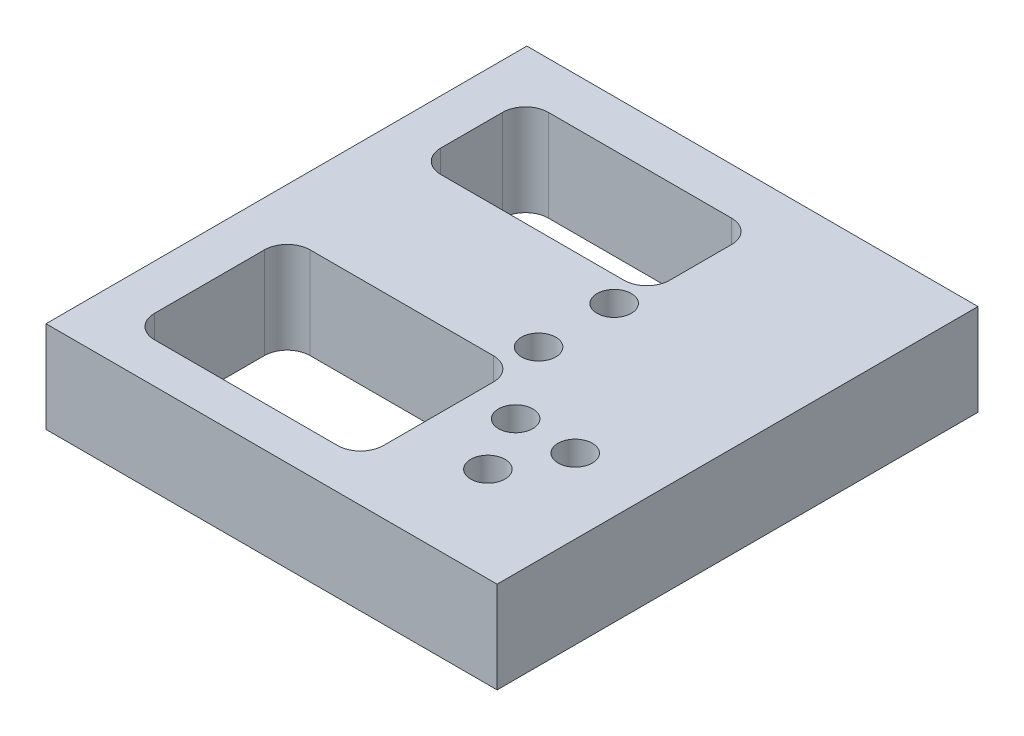
from build123d import *

# Parameters (mm, degrees)
SKETCH1_W           = 197
SKETCH1_H           = 210
BOSS_EXTRUDE1_DEPTH = 40
CUT_EXTRUDE2_REACH  = 151.423
SKETCH3_R           = 7.5
SKETCH4_R           = 9
CUT_EXTRUDE3_DEPTH  = 5


with BuildPart() as part:
    # Sketch1 → Boss-Extrude1 (new body)
    with BuildSketch(Plane(origin=(0, 0, 0), x_dir=(1, 0, 0), z_dir=(0, 1, 0))):
        Rectangle(SKETCH1_W, SKETCH1_H)
    extrude(amount=-BOSS_EXTRUDE1_DEPTH)

    # Sketch3 → Cut-Extrude2 (cut, up to next)
    with BuildSketch(Plane(origin=(0, 0, 0), x_dir=(1, 0, 0), z_dir=(0, 1, 0)), mode=Mode.PRIVATE) as cut_extrude2_sk1:
        with Locations((17.88, 26.73)):
            Circle(SKETCH3_R)
    cut_extrude2_tool1 = extrude(cut_extrude2_sk1.sketch, amount=-CUT_EXTRUDE2_REACH, mode=Mode.PRIVATE) & part.part
    # Sketch3 → Cut-Extrude2 (cut, up to next)
    with BuildSketch(Plane(origin=(0, 0, 0), x_dir=(1, 0, 0), z_dir=(0, 1, 0)), mode=Mode.PRIVATE) as cut_extrude2_sk2:
        with Locations((17.88, -6.27)):
            Circle(SKETCH3_R)
    cut_extrude2_tool2 = extrude(cut_extrude2_sk2.sketch, amount=-CUT_EXTRUDE2_REACH, mode=Mode.PRIVATE) & part.part
    # Sketch3 → Cut-Extrude2 (cut, up to next)
    with BuildSketch(Plane(origin=(0, 0, 0), x_dir=(1, 0, 0), z_dir=(0, 1, 0)), mode=Mode.PRIVATE) as cut_extrude2_sk3:
        with Locations((53, -63.53)):
            Circle(SKETCH3_R)
    cut_extrude2_tool3 = extrude(cut_extrude2_sk3.sketch, amount=-CUT_EXTRUDE2_REACH, mode=Mode.PRIVATE) & part.part
    # Sketch3 → Cut-Extrude2 (cut, up to next)
    with BuildSketch(Plane(origin=(0, 0, 0), x_dir=(1, 0, 0), z_dir=(0, 1, 0)), mode=Mode.PRIVATE) as cut_extrude2_sk4:
        with Locations((66, -38.4)):
            Circle(SKETCH3_R)
    cut_extrude2_tool4 = extrude(cut_extrude2_sk4.sketch, amount=-CUT_EXTRUDE2_REACH, mode=Mode.PRIVATE) & part.part
    # Sketch3 → Cut-Extrude2 (cut, up to next)
    with BuildSketch(Plane(origin=(0, 0, 0), x_dir=(1, 0, 0), z_dir=(0, 1, 0)), mode=Mode.PRIVATE) as cut_extrude2_sk5:
        with Locations((40, -38.4)):
            Circle(SKETCH3_R)
    cut_extrude2_tool5 = extrude(cut_extrude2_sk5.sketch, amount=-CUT_EXTRUDE2_REACH, mode=Mode.PRIVATE) & part.part
    # Sketch3 → Cut-Extrude2 (cut, up to next)
    with BuildSketch(Plane(origin=(0, 0, 0), x_dir=(1, 0, 0), z_dir=(0, 1, 0)), mode=Mode.PRIVATE) as cut_extrude2_sk6:
        with BuildLine():
            Line((-68.745, 84.63), (11.255, 84.63))
            ThreePointArc((11.255, 84.63), (18.326067812, 81.701067812), (21.255, 74.63))
            Line((21.255, 74.63), (21.255, 47.63))
            ThreePointArc((21.255, 47.63), (18.326067812, 40.558932188), (11.255, 37.63))
            Line((11.255, 37.63), (-68.745, 37.63))
            ThreePointArc((-68.745, 37.63), (-75.816067812, 40.558932188), (-78.745, 47.63))
            Line((-78.745, 47.63), (-78.745, 74.63))
            ThreePointArc((-78.745, 74.63), (-75.816067812, 81.701067812), (-68.745, 84.63))
        make_face()
    cut_extrude2_tool6 = extrude(cut_extrude2_sk6.sketch, amount=-CUT_EXTRUDE2_REACH, mode=Mode.PRIVATE) & part.part
    # Sketch3 → Cut-Extrude2 (cut, up to next)
    with BuildSketch(Plane(origin=(0, 0, 0), x_dir=(1, 0, 0), z_dir=(0, 1, 0)), mode=Mode.PRIVATE) as cut_extrude2_sk7:
        with BuildLine():
            Line((-68.745, -19.4), (11.255, -19.4))
            ThreePointArc((11.255, -19.4), (18.326067812, -22.328932188), (21.255, -29.4))
            Line((21.255, -29.4), (21.255, -77.4))
            ThreePointArc((21.255, -77.4), (18.326067812, -84.471067812), (11.255, -87.4))
            Line((11.255, -87.4), (-68.745, -87.4))
            ThreePointArc((-68.745, -87.4), (-75.816067812, -84.471067812), (-78.745, -77.4))
            Line((-78.745, -77.4), (-78.745, -29.4))
            ThreePointArc((-78.745, -29.4), (-75.816067812, -22.328932188), (-68.745, -19.4))
        make_face()
    cut_extrude2_tool7 = extrude(cut_extrude2_sk7.sketch, amount=-CUT_EXTRUDE2_REACH, mode=Mode.PRIVATE) & part.part
    add(cut_extrude2_tool1.solids().sort_by_distance((17.88, 0, -26.73))[0], mode=Mode.SUBTRACT)
    add(cut_extrude2_tool2.solids().sort_by_distance((17.88, 0, 6.27))[0], mode=Mode.SUBTRACT)
    add(cut_extrude2_tool3.solids().sort_by_distance((53, 0, 63.53))[0], mode=Mode.SUBTRACT)
    add(cut_extrude2_tool4.solids().sort_by_distance((66, 0, 38.4))[0], mode=Mode.SUBTRACT)
    add(cut_extrude2_tool5.solids().sort_by_distance((40, 0, 38.4))[0], mode=Mode.SUBTRACT)
    add(cut_extrude2_tool6.solids().sort_by_distance((-28.745, 0, -61.13))[0], mode=Mode.SUBTRACT)
    add(cut_extrude2_tool7.solids().sort_by_distance((-28.745, 0, 53.4))[0], mode=Mode.SUBTRACT)

    # Sketch4 → Cut-Extrude3 (cut)
    with BuildSketch(Plane.XZ.offset(40)):
        with Locations((17.88, -26.73)):
            Circle(SKETCH4_R)
        with Locations((17.88, 6.27)):
            Circle(SKETCH4_R)
        with Locations((40, 38.4)):
            Circle(SKETCH4_R)
        with Locations((66, 38.4)):
            Circle(SKETCH4_R)
        with Locations((53, 63.53)):
            Circle(SKETCH4_R)
    extrude(amount=-CUT_EXTRUDE3_DEPTH, mode=Mode.SUBTRACT)


solid = part.part
